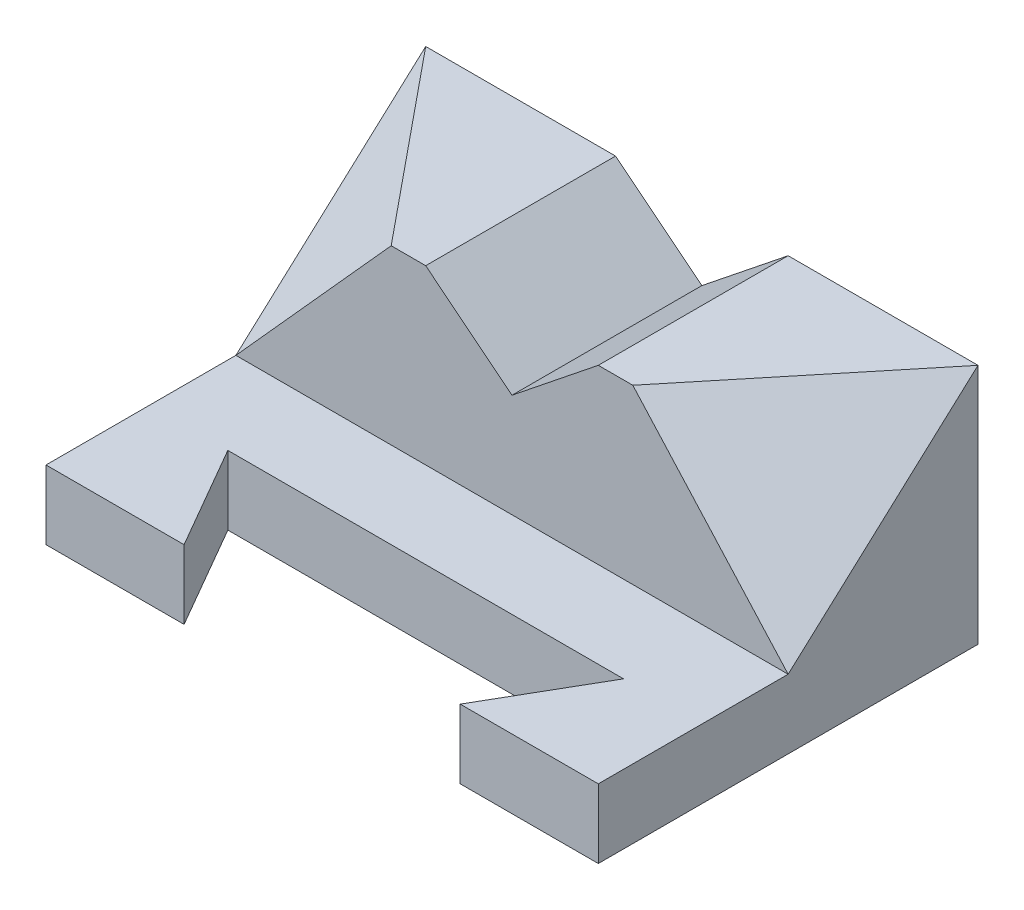
from build123d import *

# Parameters (mm, degrees)
SKETCH_1_W               = 64
SKETCH_1_H               = 44
EXTRUDE_1_DEPTH          = 8
SKETCH_2_W               = 64
SKETCH_2_H               = 22
EXTRUDE_2_DEPTH          = 20
CUT_EXTRUDE_2_DEPTH      = 44.680659336
CUT_EXTRUDE_2_DEPTH_BACK = 44.680659336
CUT_EXTRUDE_3_DEPTH      = 48.874836814
CUT_EXTRUDE_3_DEPTH_BACK = 48.874836814
CUT_EXTRUDE_4_DEPTH      = 137.737121708


with BuildPart() as part:
    # 草图1 → 凸台-拉伸1 (new body)
    with BuildSketch(Plane(origin=(0, 0, 0), x_dir=(1, 0, 0), z_dir=(0, 1, 0))):
        Rectangle(SKETCH_1_W, SKETCH_1_H)
    extrude(amount=EXTRUDE_1_DEPTH)

    # 草图2 → 凸台-拉伸2 (add)
    with BuildSketch(Plane(origin=(0, 8, 0), x_dir=(1, 0, 0), z_dir=(0, 1, 0))):
        with Locations((0, 11)):
            Rectangle(SKETCH_2_W, SKETCH_2_H)
    extrude(amount=EXTRUDE_2_DEPTH)

    # 草图3 → 切除-拉伸2 (cut, two sides: drawn at the far end of the back side and taken through both)
    with BuildSketch(Plane(origin=(0, 8, 0), x_dir=(1, 0, 0), z_dir=(0, 1, 0)).offset(-CUT_EXTRUDE_2_DEPTH_BACK)):
        Polygon((54.115282384, -143.443231477), (-16, -22), (-22.92820323, -10), (22.92820323, -10), (16, -22), (-54.115282384, -143.443231477), (-54.115282384, 137.017898061), (54.115282384, 137.017898061), align=None)
    extrude(amount=CUT_EXTRUDE_2_DEPTH + CUT_EXTRUDE_2_DEPTH_BACK, mode=Mode.SUBTRACT)

    # 草图4 → 切除-拉伸3 (cut, two sides: drawn at the far end of the back side and taken through both)
    with BuildSketch(Plane.XY.offset(-CUT_EXTRUDE_3_DEPTH_BACK)):
        Polygon((-96.641638986, 97.313311189), (-10, 28), (0, 20), (10, 28), (96.641638986, 97.313311189), (96.641638986, 319.224182615), (-96.641638986, 319.224182615), align=None)
    extrude(amount=CUT_EXTRUDE_3_DEPTH + CUT_EXTRUDE_3_DEPTH_BACK, mode=Mode.SUBTRACT)

    # Sketch 3D_3 → 切除-拉伸4 (cut, through all, along a direction that is not the sketch's normal)
    with BuildSketch(Plane(origin=(32, 8, 0), x_dir=(0, 0.6726727939963125, -0.7399400733959437), z_dir=(0.6350747116182655, 0.5715672404564379, 0.5196065822331254))):
        Polygon((0, 0), (29.732137495, 0), (13.45345588, 23.302457486), align=None)
    cut_extrude_4 = extrude(amount=CUT_EXTRUDE_4_DEPTH, dir=(0, 0, 1), mode=Mode.SUBTRACT)

    # 镜向1: 切除-拉伸4 across plane
    add(cut_extrude_4.mirror(Plane(origin=(0, 0, 0), x_dir=(0, 0, 1), z_dir=(1, 0, 0))), mode=Mode.SUBTRACT)


solid = part.part
